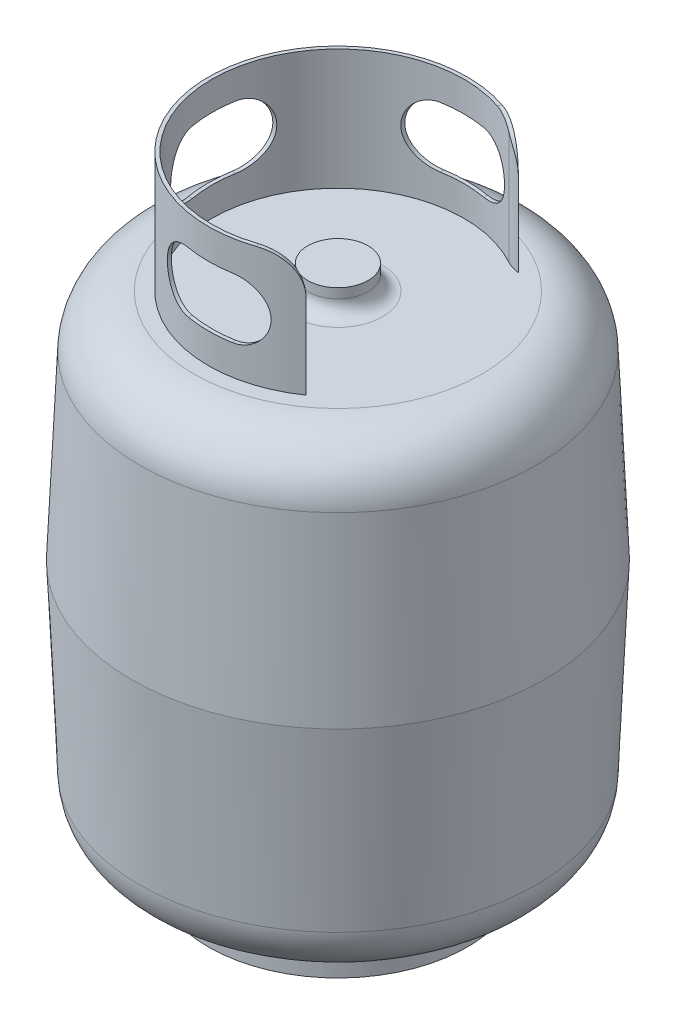
from build123d import *

# Parameters (mm, degrees)
SKETCH7_R                = 107.421871599
BOSS_EXTRUDE2_DEPTH      = 30
SKETCH12_R               = 104.421871599
CUT_EXTRUDE4_DEPTH       = 30
SKETCH14_R               = 95.421871599
CUT_EXTRUDE9_DEPTH       = 20
SKETCH15_R               = 104.421871599
CUT_EXTRUDE10_DEPTH      = 20
BOSS_EXTRUDE3_DEPTH      = 100
FILLET2_R                = 30
FILLET3_R                = 30
CUT_EXTRUDE11_DEPTH      = 545.160288764
CUT_EXTRUDE11_DEPTH_BACK = 545.160288764
CUT_EXTRUDE12_DEPTH      = 545.160288764
CUT_EXTRUDE12_DEPTH_BACK = 545.160288764


with BuildPart() as part:
    # Sketch1 → Revolve1 (revolve)
    with BuildSketch(Plane.XY, mode=Mode.PRIVATE) as revolve1_sk:
        with BuildLine():
            Line((0, 0), (119.421871599, 0))
            ThreePointArc((119.421871599, 0), (150.539959109, 12.493621707), (164.37904157, 43.037127569))
            Line((164.37904157, 43.037127569), (170.959307689, 193.75))
            Line((170.959307689, 193.75), (164.37904157, 344.462872431))
            ThreePointArc((164.37904157, 344.462872431), (150.539959109, 375.006378293), (119.421871599, 387.5))
            Line((119.421871599, 387.5), (37, 387.5))
            ThreePointArc((37, 387.5), (28.514718626, 391.014718626), (25, 399.5))
            Line((25, 399.5), (25, 407.5))
            Line((25, 407.5), (0, 407.5))
            Line((0, 407.5), (0, 403.5))
            Line((0, 403.5), (21, 403.5))
            Line((21, 403.5), (21, 399.5))
            ThreePointArc((21, 399.5), (25.686291501, 388.186291501), (37, 383.5))
            Line((37, 383.5), (119.421871599, 383.5))
            ThreePointArc((119.421871599, 383.5), (147.773906886, 372.116922444), (160.382848683, 344.288394882))
            Line((160.382848683, 344.288394882), (166.955496948, 193.75))
            Line((166.955496948, 193.75), (160.382848683, 43.211605118))
            ThreePointArc((160.382848683, 43.211605118), (147.773906886, 15.383077556), (119.421871599, 4))
            Line((119.421871599, 4), (0, 4))
            Line((0, 4), (0, 0))
        make_face()
    revolve(revolve1_sk.sketch.rotate(Axis((0, 530.744769635, 0), (0, -1, 0)), 90), axis=Axis((0, 530.744769635, 0), (0, -1, 0)))

    # Sketch7 → Boss-Extrude2 (add)
    with BuildSketch(Plane.XZ):
        with Locations(Location((0, 0, 0), (0, 0, 90))):
            Circle(SKETCH7_R)
    extrude(amount=BOSS_EXTRUDE2_DEPTH)

    # Sketch12 → Cut-Extrude4 (cut)
    with BuildSketch(Plane.XZ):
        with Locations(Location((0, 0, 0), (0, 0, 270))):
            Circle(SKETCH12_R)
    extrude(amount=-CUT_EXTRUDE4_DEPTH, mode=Mode.SUBTRACT)

    # Sketch14 → Cut-Extrude9 (cut)
    with BuildSketch(Plane.XZ.offset(30)):
        with Locations(Location((0, 0, 0), (0, 0, 270))):
            Circle(SKETCH14_R)
    extrude(amount=-CUT_EXTRUDE9_DEPTH, mode=Mode.SUBTRACT)

    # Sketch15 → Cut-Extrude10 (cut)
    with BuildSketch(Plane.XZ.offset(30)):
        with Locations(Location((0, 0, 0), (0, 0, 270))):
            Circle(SKETCH15_R)
    extrude(amount=-CUT_EXTRUDE10_DEPTH, mode=Mode.SUBTRACT)

    # Sketch16 → Boss-Extrude3 (add)
    with BuildSketch(Plane(origin=(0, 387.5, 0), x_dir=(1, 0, 0), z_dir=(0, 1, 0))):
        with BuildLine():
            Line((59.893924989, 85.537389588), (61.614654298, 87.994845721))
            ThreePointArc((61.614654298, 87.994845721), (-107.421871599, 0), (61.614654298, -87.994845721))
            Line((61.614654298, -87.994845721), (59.893924989, -85.537389588))
            ThreePointArc((59.893924989, -85.537389588), (-104.421871599, 0), (59.893924989, 85.537389588))
        make_face()
    extrude(amount=BOSS_EXTRUDE3_DEPTH)

    # Fillet2
    # the kernel refuses this fillet: 30 mm, written as the material it takes off along each edge
    with BuildSketch(Plane(origin=(16.875692262, 487.5, -24.100986267), x_dir=(0, -1, 0), z_dir=(0.5735764363510444, 0, -0.8191520442889931))) as fillet2_piece_1:
        with BuildLine():
            CenterArc((FILLET2_R, FILLET2_R), FILLET2_R, 180, 90)
            Line((0, FILLET2_R), (0, 0))
            Line((0, 0), (FILLET2_R, 0))
        make_face()
    extrude(amount=153, mode=Mode.SUBTRACT)
    with BuildSketch(Plane(origin=(59.893924989, 387.5, -85.537389588), x_dir=(0.5735764363510475, 0, -0.8191520442889908), z_dir=(0, 1, 0))) as fillet2_piece_2:
        with BuildLine():
            CenterArc((29.204072702, 14.606388117), FILLET2_R, 186.238122323, 22.89757018)
            ThreePointArc((-0.618293862, 11.346564114), (-0.154688041, 5.681698789), (0, 0))
            Line((0, 0), (3, 0))
        make_face()
    extrude(amount=128.408493944, mode=Mode.SUBTRACT)

    # Fillet3
    # the kernel refuses this fillet: 30 mm, written as the material it takes off along each edge
    with BuildSketch(Plane(origin=(104.632887024, 487.5, 149.431249043), x_dir=(0, -1, 0), z_dir=(-0.5735764363510492, 0, -0.8191520442889897))) as fillet3_piece_1:
        with BuildLine():
            CenterArc((FILLET3_R, FILLET3_R), FILLET3_R, 180, 90)
            Line((0, FILLET3_R), (0, 0))
            Line((0, 0), (FILLET3_R, 0))
        make_face()
    extrude(amount=153, mode=Mode.SUBTRACT)
    with BuildSketch(Plane(origin=(59.893924989, 387.5, 85.537389588), x_dir=(-0.8491474415238981, 0, 0.5281558695625924), z_dir=(0, 1, 0))) as fillet3_piece_2:
        with BuildLine():
            CenterArc((12.995727673, 29.955558724), FILLET3_R, 243.983368659, 22.89757018)
            Line((-0.16323301, 2.995555872), (0, 0))
            ThreePointArc((0, 0), (5.681698789, 0.154688041), (11.363397577, 0))
        make_face()
    extrude(amount=128.408493944, mode=Mode.SUBTRACT)

    # Sketch17 → Cut-Extrude11 (cut, two sides: drawn at the far end of the back side and taken through both)
    with BuildSketch(Plane.XY.offset(-CUT_EXTRUDE11_DEPTH_BACK)):
        with BuildLine():
            Line((-18, 462.5), (18, 462.5))
            ThreePointArc((18, 462.5), (43, 437.5), (18, 412.5))
            Line((18, 412.5), (-18, 412.5))
            ThreePointArc((-18, 412.5), (-43, 437.5), (-18, 462.5))
        make_face()
    extrude(amount=CUT_EXTRUDE11_DEPTH + CUT_EXTRUDE11_DEPTH_BACK, mode=Mode.SUBTRACT)

    # Sketch18 → Cut-Extrude12 (cut, two sides: drawn at the far end of the back side and taken through both)
    with BuildSketch(Plane(origin=(0, 0, 0), x_dir=(0, 0, -1), z_dir=(1, 0, 0)).offset(-CUT_EXTRUDE12_DEPTH_BACK)):
        with BuildLine():
            Line((-18, 463.5), (18, 463.5))
            ThreePointArc((18, 463.5), (44, 437.5), (18, 411.5))
            Line((18, 411.5), (-18, 411.5))
            ThreePointArc((-18, 411.5), (-44, 437.5), (-18, 463.5))
        make_face()
    extrude(amount=CUT_EXTRUDE12_DEPTH + CUT_EXTRUDE12_DEPTH_BACK, mode=Mode.SUBTRACT)


solid = part.part
